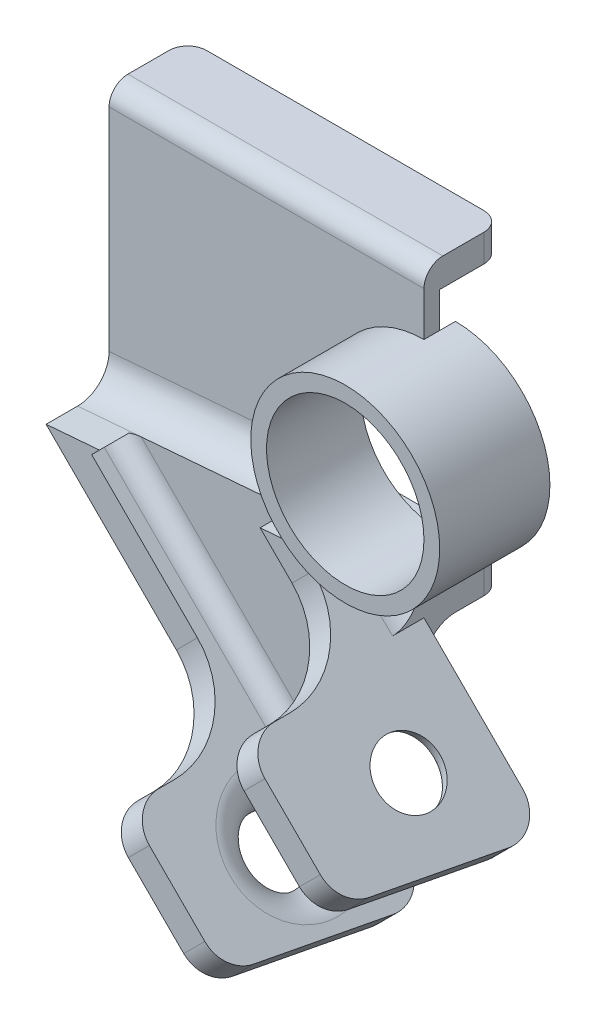
from build123d import *

# Parameters (mm, degrees)
CROQUIS1_R                   = 6
CROQUIS1_R_2                 = 5
SALIENTE_EXTRUIR1_DEPTH      = 7
SALIENTE_EXTRUIR2_DEPTH      = 3
SALIENTE_EXTRUIR2_DEPTH_BACK = 2
CROQUIS4_W                   = 20
CROQUIS4_H                   = 16.5
CORTAR_EXTRUIR1_DEPTH        = 4
SALIENTE_EXTRUIR7_DEPTH      = 4
CORTAR_EXTRUIR4_DEPTH        = 4
CORTAR_EXTRUIR5_DEPTH        = 2.2
SALIENTE_EXTRUIR9_DEPTH      = 8
CORTAR_EXTRUIR6_REACH        = 36.518
CROQUIS13_R                  = 2
REDONDEO1_R                  = 2
CROQUIS14_W                  = 1.8
CROQUIS14_H                  = 8.5
CORTAR_EXTRUIR7_DEPTH        = 10.5
CROQUIS15_W                  = 2
CROQUIS15_H                  = 8.5
CORTAR_EXTRUIR8_DEPTH        = 14.5
REDONDEO2_R                  = 2
REDONDEO3_R                  = 2
REDONDEO4_R                  = 5
CORTAR_EXTRUIR9_REACH        = 36.518
REDONDEO5_R                  = 2
REDONDEO6_R                  = 1.2
REDONDEO7_R                  = 1.2


with BuildPart() as part:
    # Croquis1 → Saliente-Extruir1 (new body)
    with BuildSketch(Plane.XY):
        Circle(CROQUIS1_R)
        Circle(CROQUIS1_R_2, mode=Mode.SUBTRACT)
    extrude(amount=SALIENTE_EXTRUIR1_DEPTH)

    # Croquis2 → Saliente-Extruir2 (add, two sides: drawn at the far end of the back side and taken through both)
    with BuildSketch(Plane(origin=(0, 0, 0), x_dir=(-1, 0, 0), z_dir=(0, 0, -1)).offset(-SALIENTE_EXTRUIR2_DEPTH_BACK)):
        with BuildLine():
            Line((0, -10), (0, -5))
            ThreePointArc((0, -5), (5, 0), (0, 5))
            Line((0, 5), (0, 10))
            Line((0, 10), (20, 10))
            Line((20, 10), (20, -10))
            Line((20, -10), (0, -10))
        make_face()
    extrude(amount=SALIENTE_EXTRUIR2_DEPTH + SALIENTE_EXTRUIR2_DEPTH_BACK)

    # Croquis4 → Cortar-Extruir1 (cut)
    with BuildSketch(Plane(origin=(0, 0, -3), x_dir=(-1, 0, 0), z_dir=(0, 0, -1))):
        with Locations((10, 0)):
            Rectangle(CROQUIS4_W, CROQUIS4_H)
    extrude(amount=-CORTAR_EXTRUIR1_DEPTH, mode=Mode.SUBTRACT)

    # Croquis5 → Saliente-Extruir7 (add)
    with BuildSketch(Plane.XY.offset(2)):
        Polygon((-3.9473557, -5.357801084), (-20, -6.659228144), (0.707205479, -27.366433624), (16.75984978, -26.065006564), align=None)
    extrude(amount=SALIENTE_EXTRUIR7_DEPTH)

    # Croquis10 → Cortar-Extruir4 (cut)
    with BuildSketch(Plane.XY.offset(6)):
        Polygon((-0.765202985, -25.894025159), (7.911832695, -17.216989479), (16.75984978, -26.065006564), (0.707205479, -27.366433624), align=None)
    extrude(amount=-CORTAR_EXTRUIR4_DEPTH, mode=Mode.SUBTRACT)

    # Croquis11 → Cortar-Extruir5 (cut)
    with BuildSketch(Plane.XY.offset(6)):
        Polygon((0.572064306, -24.556757867), (6.582471946, -18.546350227), (-0.842149256, -11.121729025), (-6.852556896, -17.132136665), align=None)
    extrude(amount=-CORTAR_EXTRUIR5_DEPTH, mode=Mode.SUBTRACT)

    # Croquis12 → Saliente-Extruir9 (add)
    with BuildSketch(Plane.XY.offset(6)):
        Polygon((-6.852556896, -17.132136665), (-8.189824188, -18.469403956), (-0.765202985, -25.894025159), (0.572064306, -24.556757867), align=None)
        Polygon((-0.842149256, -11.121729025), (0.487211492, -9.792368276), (7.911832695, -17.216989479), (6.582471946, -18.546350227), align=None)
    extrude(amount=SALIENTE_EXTRUIR9_DEPTH)

    # Cortar-Extruir6: up to this face of the body (flat: up to its plane)
    cortar_extruir6_end = Plane(part.part.faces().sort_by_distance((3.21499462, -12.520151404, 7.335855075))[0])
    # Croquis13 → Cortar-Extruir6 (cut, up to the picked face)
    with BuildSketch(Plane(origin=(-13.329614072, -13.329614072, 0), x_dir=(0, 0, 1), z_dir=(-0.7071067811865488, -0.7071067811865462, 0)), mode=Mode.PRIVATE) as cortar_extruir6_sk1:
        with Locations(Location((7, -12.268760562, 0), (0, 0, 270))):
            Circle(CROQUIS13_R)
    cortar_extruir6_tool1 = split(extrude(cortar_extruir6_sk1.sketch, amount=-CORTAR_EXTRUIR6_REACH, mode=Mode.PRIVATE), bisect_by=cortar_extruir6_end, keep=Keep.BOTH, mode=Mode.PRIVATE)
    add(cortar_extruir6_tool1.solids().sort_by(Axis((-4.65429, -22.004938, 7), (0.7071067811865488, 0.7071067811865462, 0)))[0], mode=Mode.SUBTRACT)

    # Redondeo1
    # the kernel refuses this fillet: 2 mm, written as the material it takes off along each edge
    with BuildSketch(Plane(origin=(-3.31702299, -20.667670571, 7), x_dir=(0.7071067811865459, -0.7071067811865492, 0), z_dir=(0, 0, -1))) as redondeo1_piece_1_section:
        with BuildLine():
            CenterArc((3.997037442, 2), REDONDEO1_R, 183.11895941, 86.88104059)
            Line((2, 1.89118154), (1.960059251, 1.889005171))
            ThreePointArc((1.960059251, 1.889005171), (1.96, 0.94559077), (1.96, 0))
            Line((1.96, 0), (2, -0.04))
            Line((2, -0.04), (3.997037442, -0.04))
            Line((3.997037442, -0.04), (3.997037442, 0))
        make_face()
    redondeo1_piece_1 = revolve(axis=Axis((-3.31702299, -20.667670571, 7), (-0.7071067811865488, -0.7071067811865462, 0)), mode=Mode.PRIVATE)
    redondeo1_piece_1 = split(redondeo1_piece_1, bisect_by=Plane(origin=(-3.31702299, -20.667670571, 3.8), z_dir=(0, 0, 1)), keep=Keep.TOP, mode=Mode.PRIVATE)
    add(redondeo1_piece_1, mode=Mode.SUBTRACT)
    with BuildSketch(Plane(origin=(2.69338465, -14.657262931, 7), x_dir=(0.7071067811865458, -0.7071067811865493, 0), z_dir=(0, 0, -1))) as redondeo1_piece_2_section:
        with BuildLine():
            CenterArc((3.996396754, -2), REDONDEO1_R, 90, 86.560187232)
            Line((3.996396754, 0), (3.996396754, 0.04))
            Line((3.996396754, 0.04), (2, 0.04))
            Line((2, 0.04), (1.96, 0))
            ThreePointArc((1.96, 0), (1.96, -0.94), (1.960072065, -1.8776))
            Line((1.960072065, -1.8776), (2, -1.88))
        make_face()
    redondeo1_piece_2 = revolve(axis=Axis((2.69338465, -14.657262931, 7), (-0.7071067811865488, -0.7071067811865462, 0)), mode=Mode.PRIVATE)
    redondeo1_piece_2 = split(redondeo1_piece_2, bisect_by=Plane(origin=(2.69338465, -14.657262931, 3.8), z_dir=(0, 0, 1)), keep=Keep.TOP, mode=Mode.PRIVATE)
    add(redondeo1_piece_2, mode=Mode.SUBTRACT)

    # Croquis14 → Cortar-Extruir7 (cut)
    with BuildSketch(Plane(origin=(12.564411087, -12.564411087, 0), x_dir=(0, 0, -1), z_dir=(0.7071067811865477, -0.7071067811865474, 0))):
        with Locations((-2.9, -12.709739462)):
            Rectangle(CROQUIS14_W, CROQUIS14_H)
    extrude(amount=-CORTAR_EXTRUIR7_DEPTH, mode=Mode.SUBTRACT)

    # Croquis15 → Cortar-Extruir8 (cut)
    with BuildSketch(Plane(origin=(5.139789884, -5.139789884, 0), x_dir=(0, 0, -1), z_dir=(0.7071067811865476, -0.7071067811865476, 0))):
        with Locations((-5, -12.709739462)):
            Rectangle(CROQUIS15_W, CROQUIS15_H)
    extrude(amount=-CORTAR_EXTRUIR8_DEPTH, mode=Mode.SUBTRACT)

    # Redondeo2
    # the kernel refuses this fillet: 2 mm, written as the material it adds along each edge
    with BuildSketch(Plane(origin=(-21.659228144, -10, 2), x_dir=(0, -1, 0), z_dir=(1, 0, 0))) as redondeo2_piece_1_section:
        with BuildLine():
            CenterArc((REDONDEO2_R, REDONDEO2_R), REDONDEO2_R, 180, 90)
            Line((0, REDONDEO2_R), (0, 0))
            Line((0, 0), (REDONDEO2_R, 0))
        make_face()
    redondeo2_piece_1 = extrude(amount=21.659228144, mode=Mode.PRIVATE)
    redondeo2_piece_1 = split(redondeo2_piece_1, bisect_by=Plane(origin=(-19.159228144, -7.5, 2), z_dir=(0.7071067811865488, 0.7071067811865464, 0)), keep=Keep.TOP, mode=Mode.PRIVATE)
    redondeo2_piece_1 = split(redondeo2_piece_1, bisect_by=Plane(origin=(-10.689824188, -20.969403956, 2), z_dir=(-0.7071067811865477, 0.7071067811865474, 0)), keep=Keep.TOP, mode=Mode.PRIVATE)
    add(redondeo2_piece_1)
    with BuildSketch(Plane(origin=(-21.659228144, -10, 2), x_dir=(0, -1, 0), z_dir=(1, 0, 0))) as redondeo2_piece_2_section:
        with BuildLine():
            CenterArc((REDONDEO2_R, REDONDEO2_R), REDONDEO2_R, 180, 90)
            Line((0, REDONDEO2_R), (0, 0))
            Line((0, 0), (REDONDEO2_R, 0))
        make_face()
    redondeo2_piece_2 = extrude(amount=21.659228144, mode=Mode.PRIVATE)
    redondeo2_piece_2 = split(redondeo2_piece_2, bisect_by=Plane(origin=(-11.811553213, -0.152325068, 2), z_dir=(0.7071067811865476, 0.7071067811865476, 0)), keep=Keep.TOP, mode=Mode.PRIVATE)
    add(redondeo2_piece_2)
    with BuildSketch(Plane(origin=(3.535533906, -12.84069069, 2), x_dir=(0.7071067811865488, 0.7071067811865464, 0), z_dir=(-0.7071067811865464, 0.7071067811865488, 0))) as redondeo2_piece_3_section:
        with BuildLine():
            CenterArc((REDONDEO2_R, -REDONDEO2_R), REDONDEO2_R, 90, 90)
            Line((0, -REDONDEO2_R), (0, 0))
            Line((0, 0), (REDONDEO2_R, 0))
        make_face()
    redondeo2_piece_3 = extrude(amount=15.582403966, mode=Mode.PRIVATE)
    redondeo2_piece_3 = split(redondeo2_piece_3, bisect_by=Plane(origin=(0, -12.84069069, 2), z_dir=(-1, 0, 0)), keep=Keep.TOP, mode=Mode.PRIVATE)
    redondeo2_piece_3 = split(redondeo2_piece_3, bisect_by=Plane(origin=(2.883977199, -4.80396825, 2), z_dir=(0.0808073133091507, -0.9967297417634114, 0)), keep=Keep.TOP, mode=Mode.PRIVATE)
    add(redondeo2_piece_3)
    with BuildSketch(Plane(origin=(1.036293009, -4.953764518, 2), x_dir=(-0.08080731330915071, 0.9967297417634114, 0), z_dir=(-0.9967297417634114, -0.0808073133091507, 0))) as redondeo2_piece_4_section:
        with BuildLine():
            CenterArc((REDONDEO2_R, -REDONDEO2_R), REDONDEO2_R, 90, 90)
            Line((0, -REDONDEO2_R), (0, 0))
            Line((0, 0), (REDONDEO2_R, 0))
        make_face()
    redondeo2_piece_4 = extrude(amount=26.105312832, mode=Mode.PRIVATE)
    redondeo2_piece_4 = split(redondeo2_piece_4, bisect_by=Plane(origin=(-20, -4.953764518, 2), z_dir=(1, 0, 0)), keep=Keep.TOP, mode=Mode.PRIVATE)
    redondeo2_piece_4 = split(redondeo2_piece_4, bisect_by=Plane(origin=(-1.657549628, -7.647607155, 2), z_dir=(-0.7071067811865488, -0.7071067811865464, 0)), keep=Keep.TOP, mode=Mode.PRIVATE)
    add(redondeo2_piece_4)
    with BuildSketch(Plane(origin=(3.535533906, -12.84069069, 2), x_dir=(0.7071067811865488, 0.7071067811865464, 0), z_dir=(-0.7071067811865464, 0.7071067811865488, 0))) as redondeo2_piece_5a_section:
        with BuildLine():
            CenterArc((REDONDEO2_R, -REDONDEO2_R), REDONDEO2_R, 90, 90)
            Line((0, -REDONDEO2_R), (0, 0))
            Line((0, 0), (REDONDEO2_R, 0))
        make_face()
    redondeo2_piece_5a = extrude(amount=15.582403966, mode=Mode.PRIVATE)
    redondeo2_piece_5a = redondeo2_piece_5a - Plane(origin=(0, 0, 2), x_dir=(1, 0, 0), z_dir=(0, 0, -1)) * Cylinder(6, 40, mode=Mode.PRIVATE)
    redondeo2_piece_5a = split(redondeo2_piece_5a, bisect_by=Plane(origin=(2.883977199, -4.80396825, 2), z_dir=(-0.0808073133091507, 0.9967297417634114, 0)), keep=Keep.TOP, mode=Mode.PRIVATE)
    with BuildSketch(Plane(origin=(1.036293009, -4.953764518, 2), x_dir=(-0.08080731330915071, 0.9967297417634114, 0), z_dir=(-0.9967297417634114, -0.0808073133091507, 0))) as redondeo2_piece_5b_section:
        with BuildLine():
            CenterArc((REDONDEO2_R, -REDONDEO2_R), REDONDEO2_R, 90, 90)
            Line((0, -REDONDEO2_R), (0, 0))
            Line((0, 0), (REDONDEO2_R, 0))
        make_face()
    redondeo2_piece_5b = extrude(amount=26.105312832, mode=Mode.PRIVATE)
    redondeo2_piece_5b = redondeo2_piece_5b - Plane(origin=(0, 0, 2), x_dir=(1, 0, 0), z_dir=(0, 0, -1)) * Cylinder(6, 61, mode=Mode.PRIVATE)
    redondeo2_piece_5b = split(redondeo2_piece_5b, bisect_by=Plane(origin=(-1.657549628, -7.647607155, 2), z_dir=(0.7071067811865488, 0.7071067811865464, 0)), keep=Keep.TOP, mode=Mode.PRIVATE)
    redondeo2_piece_5 = redondeo2_piece_5a & redondeo2_piece_5b
    add(redondeo2_piece_5)

    # Redondeo3
    redondeo3_edges = [part.edges().sort_by_distance(p)[0] for p in [
        (-18.329614072, -8.329614072, 2),
    ]]
    fillet(redondeo3_edges, radius=REDONDEO3_R)

    # Redondeo4
    redondeo4_edges = [part.edges().sort_by_distance(p)[0] for p in [
        (-7.521190542, -17.800770311, 6),
        (-0.177468882, -10.457048651, 6),
    ]]
    fillet(redondeo4_edges, radius=REDONDEO4_R)

    # Cortar-Extruir9: up to this face of the body (flat: up to its plane)
    cortar_extruir9_end = Plane(part.part.faces().sort_by_distance((-3.497839057, -5.807317727, 5.793776651))[0])
    # Croquis16 → Cortar-Extruir9 (cut, up to the picked face)
    with BuildSketch(Plane(origin=(-13.329614072, -13.329614072, 0), x_dir=(0, 0, 1), z_dir=(-0.7071067811865488, -0.7071067811865462, 0)), mode=Mode.PRIVATE) as cortar_extruir9_sk1:
        Polygon((2, -17.768760562), (14, -15.968760562), (14, -17.768760562), align=None)
    cortar_extruir9_tool1 = split(extrude(cortar_extruir9_sk1.sketch, amount=-CORTAR_EXTRUIR9_REACH, mode=Mode.PRIVATE), bisect_by=cortar_extruir9_end, keep=Keep.BOTH, mode=Mode.PRIVATE)
    add(cortar_extruir9_tool1.solids().sort_by(Axis((-1.189467, -25.469761, 10), (0.7071067811865488, 0.7071067811865462, 0)))[0], mode=Mode.SUBTRACT)

    # Redondeo5
    redondeo5_edges = [part.edges().sort_by_distance(p)[0] for p in [
        (-7.521190542, -17.800770311, 14),
        (-0.177468882, -10.457048651, 14),
        (-0.09656934, -25.225391513, 2),
        (-1.369361546, -23.952599307, 14),
        (5.974360114, -16.608877647, 14),
        (7.24715232, -17.881669853, 2),
    ]]
    fillet(redondeo5_edges, radius=REDONDEO5_R)

    # Redondeo6
    # the kernel refuses this fillet: 1.2 mm, written as the material it adds along each edge
    with BuildSketch(Plane(origin=(-6.852556896, -17.132136665, 4), x_dir=(0.7071067811865482, -0.7071067811865468, 0), z_dir=(0, 0, -1))) as redondeo6_piece_1:
        with BuildLine():
            CenterArc((REDONDEO6_R, -REDONDEO6_R), REDONDEO6_R, 90, 90)
            Line((0, -REDONDEO6_R), (0, 0))
            Line((0, 0), (REDONDEO6_R, 0))
        make_face()
    extrude(amount=2)
    with BuildSketch(Plane(origin=(-0.842149256, -11.121729025, -1.2031583), x_dir=(-0.7071067811865542, -0.7071067811865409, -7.347476233374363e-14), z_dir=(0, 0, 1))) as redondeo6_piece_2_section:
        with BuildLine():
            CenterArc((REDONDEO6_R, REDONDEO6_R), REDONDEO6_R, 180, 90)
            Line((0, REDONDEO6_R), (0, 0))
            Line((0, 0), (REDONDEO6_R, 0))
        make_face()
    redondeo6_piece_2 = extrude(amount=5.2031583, mode=Mode.PRIVATE)
    redondeo6_piece_2 = redondeo6_piece_2 - Plane(origin=(-0.842149256, -12, 0), x_dir=(0, -1, 0), z_dir=(-1, 0, 0)) * Cylinder(2, 16, mode=Mode.PRIVATE)
    redondeo6_piece_2 = split(redondeo6_piece_2, bisect_by=Plane(origin=(0, -11.121729025, -1.2031583), z_dir=(-1, 0, 0)), keep=Keep.TOP, mode=Mode.PRIVATE)
    add(redondeo6_piece_2)
    with BuildSketch(Plane(origin=(-0.842149256, -11.121729025, -1.2031583), x_dir=(-0.7071067811865542, -0.7071067811865409, -7.347476233374363e-14), z_dir=(0, 0, 1))) as redondeo6_piece_3_section:
        with BuildLine():
            CenterArc((REDONDEO6_R, REDONDEO6_R), REDONDEO6_R, 180, 90)
            Line((0, REDONDEO6_R), (0, 0))
            Line((0, 0), (REDONDEO6_R, 0))
        make_face()
    redondeo6_piece_3 = extrude(amount=5.2031583, mode=Mode.PRIVATE)
    redondeo6_piece_3 = split(redondeo6_piece_3, bisect_by=Plane(origin=(-0.842149256, -11.121729025, 2), z_dir=(0, 0, 1)), keep=Keep.TOP, mode=Mode.PRIVATE)
    add(redondeo6_piece_3)
    with BuildSketch(Plane(origin=(-6.852556896, -17.132136665, 4), x_dir=(0, 0, 1), z_dir=(-0.7071067811865476, 0.7071067811865476, 0))) as redondeo6_piece_4_section:
        with BuildLine():
            CenterArc((REDONDEO6_R, REDONDEO6_R), REDONDEO6_R, 180, 90)
            Line((0, REDONDEO6_R), (0, 0))
            Line((0, 0), (REDONDEO6_R, 0))
        make_face()
    redondeo6_piece_4 = extrude(amount=17.5, mode=Mode.PRIVATE)
    redondeo6_piece_4 = split(redondeo6_piece_4, bisect_by=Plane(origin=(-7.781927379, -5.668679171, 4), z_dir=(0.08080731330903411, -0.9967297417634209, 0)), keep=Keep.TOP, mode=Mode.PRIVATE)
    add(redondeo6_piece_4)
    with BuildSketch(Plane(origin=(-0.842149256, -11.121729025, 4), x_dir=(0, 0, 1), z_dir=(-0.7071067811865476, 0.7071067811865476, 0))) as redondeo6_piece_5_section:
        with BuildLine():
            CenterArc((REDONDEO6_R, -REDONDEO6_R), REDONDEO6_R, 90, 90)
            Line((0, -REDONDEO6_R), (0, 0))
            Line((0, 0), (REDONDEO6_R, 0))
        make_face()
    redondeo6_piece_5 = extrude(amount=10.869452862, mode=Mode.PRIVATE)
    redondeo6_piece_5 = split(redondeo6_piece_5, bisect_by=Plane(origin=(-1.326670052, -5.145335701, 4), z_dir=(0.08080731330903411, -0.9967297417634209, 0)), keep=Keep.TOP, mode=Mode.PRIVATE)
    add(redondeo6_piece_5)
    with BuildSketch(Plane(origin=(-6.852556896, -17.132136665, 7), x_dir=(0.7071067811865482, -0.7071067811865468, 0), z_dir=(0, 0, -1))) as redondeo6_piece_6a_section:
        with BuildLine():
            CenterArc((REDONDEO6_R, -REDONDEO6_R), REDONDEO6_R, 90, 90)
            Line((0, -REDONDEO6_R), (0, 0))
            Line((0, 0), (REDONDEO6_R, 0))
        make_face()
    redondeo6_piece_6a = extrude(amount=5, mode=Mode.PRIVATE)
    redondeo6_piece_6a = split(redondeo6_piece_6a, bisect_by=Plane(origin=(-6.852556896, -17.132136665, 4), z_dir=(0, 0, 1)), keep=Keep.TOP, mode=Mode.PRIVATE)
    with BuildSketch(Plane(origin=(-4.731236553, -19.253457008, 4), x_dir=(0, 0, 1), z_dir=(-0.7071067811865476, 0.7071067811865476, 0))) as redondeo6_piece_6b_section:
        with BuildLine():
            CenterArc((REDONDEO6_R, REDONDEO6_R), REDONDEO6_R, 180, 90)
            Line((0, REDONDEO6_R), (0, 0))
            Line((0, 0), (REDONDEO6_R, 0))
        make_face()
    redondeo6_piece_6b = extrude(amount=17.5, mode=Mode.PRIVATE)
    redondeo6_piece_6b = split(redondeo6_piece_6b, bisect_by=Plane(origin=(-6.852556896, -17.132136665, 4), z_dir=(0.7071067811865476, -0.7071067811865476, 0)), keep=Keep.TOP, mode=Mode.PRIVATE)
    redondeo6_piece_6 = redondeo6_piece_6a & redondeo6_piece_6b
    add(redondeo6_piece_6)
    with BuildSketch(Plane(origin=(-0.842149256, -11.121729025, -1.2031583), x_dir=(-0.7071067811865542, -0.7071067811865409, -7.347476233374363e-14), z_dir=(0, 0, 1))) as redondeo6_piece_7a_section:
        with BuildLine():
            CenterArc((REDONDEO6_R, REDONDEO6_R), REDONDEO6_R, 180, 90)
            Line((0, REDONDEO6_R), (0, 0))
            Line((0, 0), (REDONDEO6_R, 0))
        make_face()
    redondeo6_piece_7a = extrude(amount=8.2031583, mode=Mode.PRIVATE)
    redondeo6_piece_7a = split(redondeo6_piece_7a, bisect_by=Plane(origin=(-0.842149256, -11.121729025, 4), z_dir=(0, 0, 1)), keep=Keep.TOP, mode=Mode.PRIVATE)
    with BuildSketch(Plane(origin=(1.279171087, -13.243049368, 4), x_dir=(0, 0, 1), z_dir=(-0.7071067811865476, 0.7071067811865476, 0))) as redondeo6_piece_7b_section:
        with BuildLine():
            CenterArc((REDONDEO6_R, -REDONDEO6_R), REDONDEO6_R, 90, 90)
            Line((0, -REDONDEO6_R), (0, 0))
            Line((0, 0), (REDONDEO6_R, 0))
        make_face()
    redondeo6_piece_7b = extrude(amount=13.869452862, mode=Mode.PRIVATE)
    redondeo6_piece_7b = split(redondeo6_piece_7b, bisect_by=Plane(origin=(-0.842149256, -11.121729025, 4), z_dir=(0.7071067811865476, -0.7071067811865476, 0)), keep=Keep.TOP, mode=Mode.PRIVATE)
    redondeo6_piece_7 = redondeo6_piece_7a & redondeo6_piece_7b
    add(redondeo6_piece_7)

    # Redondeo7
    redondeo7_edges = [part.edges().sort_by_distance(p)[0] for p in [
        (-10, 10, 2),
        (-20, -9.125, -3),
        (0, 9.125, -3),
        (-20, 9.125, -3),
        (0, -9.125, -3),
    ]]
    fillet(redondeo7_edges, radius=REDONDEO7_R)


solid = part.part
